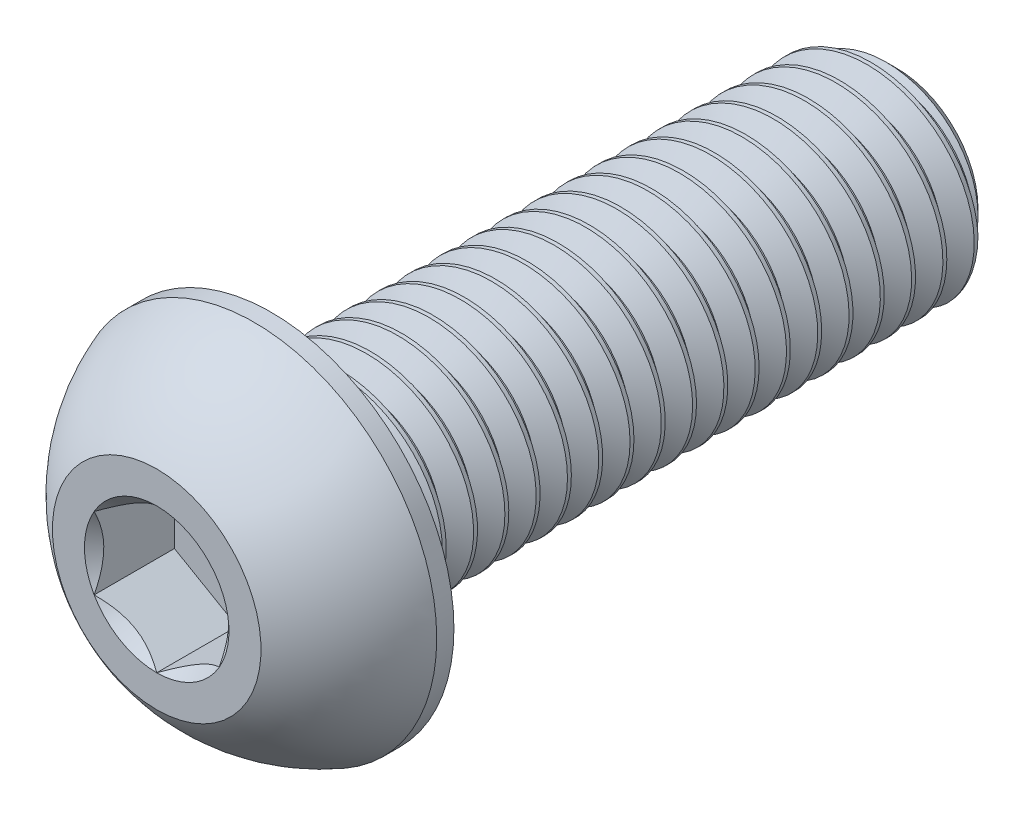
from build123d import *

# Parameters (mm, degrees)
CUT_EXTRUDE2_DEPTH = 3.85
CUT_SWEEP2_PITCH   = 1.5
CUT_SWEEP2_TO      = 30


with BuildPart() as part:
    # Sketch10 → Revolve3 (revolve)
    with BuildSketch(Plane(origin=(0, 0, 0), x_dir=(0, 0, -1), z_dir=(1, 0, 0)), mode=Mode.PRIVATE) as revolve3_sk:
        Polygon((34.375, 5), (35.5, 3.875), (35.5, 0), (5.5, 0), (5.5, 5), align=None)
    revolve(revolve3_sk.sketch.rotate(Axis((0, 0, 0), (0, 0, -1)), 90), axis=Axis((0, 0, 0), (0, 0, -1)))

    # Sketch7 → Revolve2 (revolve)
    with BuildSketch(Plane(origin=(0, 0, 0), x_dir=(0, 0, -1), z_dir=(1, 0, 0)), mode=Mode.PRIVATE) as revolve2_sk:
        with BuildLine():
            Line((4.675, 8.75), (5.5, 8.75))
            Line((5.5, 8.75), (5.5, 0))
            Line((5.5, 0), (0, 0))
            Line((0, 0), (0, 5))
            ThreePointArc((0, 5), (2.027465032, 7.26151026), (4.675, 8.75))
        make_face()
    revolve(revolve2_sk.sketch.rotate(Axis((0, 0, 0), (0, 0, -1)), 180), axis=Axis((0, 0, 0), (0, 0, -1)))

    # Sketch5 → Cut-Extrude2 (cut)
    with BuildSketch(Plane.XY):
        Polygon((3, -1.732050808), (3, 1.732050808), (0, 3.464101615), (-3, 1.732050808), (-3, -1.732050808), (0, -3.464101615), align=None)
    extrude(amount=-CUT_EXTRUDE2_DEPTH, mode=Mode.SUBTRACT)

    # Cut-Extrude3 cone 1 section (through the dimple's axis) → Cut-Extrude3 (revolve, cut)
    with BuildSketch(Plane(origin=(0, 0, 0), x_dir=(0, -1, 0), z_dir=(1, 0, 0))):
        Polygon((0, 0), (3.464101615, 0), (0, 3.464101615), align=None)
    revolve(axis=Axis((0, 0, 0), (0, 0, -1)), mode=Mode.SUBTRACT)


with BuildPart() as body_2:
    # Split1: read off the stored shape, not the designer's step
    # Split1: the piece on the far side of the plane
    add(part.part)
    split(bisect_by=Plane.XY.offset(-5.5), keep=Keep.BOTTOM)

    # Cut-Sweep2: arcs per turn and ends read off the stored shape
    # Cut-Sweep2: the profile of Sketch12 screwed along a right-hand helix through 25 turns, 8 arcs to a turn; built about Z, then put on its axis
    cut_sweep2_z = Axis((0, 0, 0), (0, 0, 1))
    cut_sweep2_corners = [(4.025721421, 0, -0.5625), (4.025721421, 0, -0.75), (5.081189882, 0, -1.359375), (5.081189882, 0, 0.046875)]
    with BuildLine(mode=Mode.PRIVATE) as cut_sweep2_profile:
        Line(cut_sweep2_corners[0], cut_sweep2_corners[1])
        Line(cut_sweep2_corners[1], cut_sweep2_corners[2])
        Line(cut_sweep2_corners[2], cut_sweep2_corners[3])
        Line(cut_sweep2_corners[3], cut_sweep2_corners[0])
    cut_sweep2_cap = Face(cut_sweep2_profile.wire())
    cut_sweep2_turn_angles = [0, 22.5, 45, 67.5, 90, 112.5, 135, 157.5, 180, 202.5, 225, 247.5, 270, 292.5, 315, 337.5, 360]
    cut_sweep2_turn_weights = [1, 0.9238795325112867, 1, 0.9238795325112867, 1, 0.9238795325112867, 1, 0.9238795325112867, 1, 0.9238795325112867, 1, 0.9238795325112867, 1, 0.9238795325112867, 1, 0.9238795325112867, 1]
    cut_sweep2_turn_rails = [Edge.make_bspline([Vector(p[0], p[1], 0).rotate(cut_sweep2_z, cut_sweep2_turn_angles[k]) / cut_sweep2_turn_weights[k] + Vector(0, 0, p[2] + CUT_SWEEP2_PITCH * cut_sweep2_turn_angles[k] / 360) for k in range(17)], [0, 0, 0, 1, 1, 2, 2, 3, 3, 4, 4, 5, 5, 6, 6, 7, 7, 8, 8, 8], 2, cut_sweep2_turn_weights) for p in cut_sweep2_corners]
    cut_sweep2_turn_sides = [Face.make_surface_from_curves(cut_sweep2_turn_rails[p[0]], cut_sweep2_turn_rails[p[1]]) for p in [(0, 1), (1, 2), (2, 3), (3, 0)]]
    cut_sweep2 = Plane(origin=(0, 0, -35.5), x_dir=(0, 1, 0), z_dir=(0, 0, 1)) * split(Solid(Shell([*[p.moved(Location((0, 0, CUT_SWEEP2_PITCH * i))) for i in range(25) for p in cut_sweep2_turn_sides], cut_sweep2_cap, cut_sweep2_cap.rotate(cut_sweep2_z, 9000).moved(Location((0, 0, CUT_SWEEP2_PITCH * 9000 / 360)))])), bisect_by=Plane.XY.offset(CUT_SWEEP2_TO), keep=Keep.BOTTOM, mode=Mode.PRIVATE)
    add(cut_sweep2, mode=Mode.SUBTRACT)


with BuildPart() as part_1:
    add(part.part)

    # Split1
    split(bisect_by=Plane.XY.offset(-5.5), keep=Keep.TOP)

    add(body_2.part)  # Boss-Extrude1 merges body 2
    # Boss-Extrude1: read off the stored shape, not the designer's step
    # Boss-Extrude1 outline → Boss-Extrude1 (revolve)
    with BuildSketch(Plane.XZ):
        Polygon((4.025721421, -5.5), (4.025721421, -6.474278579), (5, -5.5), align=None)
    revolve(axis=Axis((0, 0, 0), (0, 0, 1)))


solid = part_1.part
